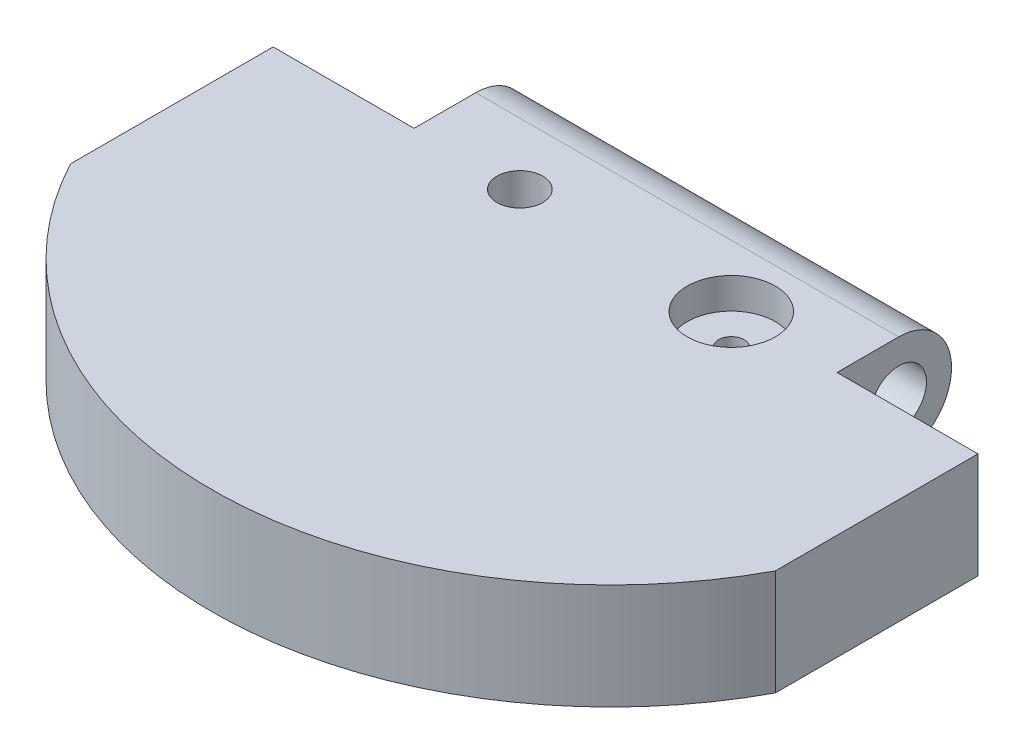
from build123d import *

# Parameters (mm, degrees)
BOSS_EXTRUDE1_DEPTH = 12
FILLET1_R           = 6
SKETCH2_R           = 3.15
CUT_EXTRUDE1_DEPTH  = 70
CUT_EXTRUDE2_START  = -12
SKETCH3_R           = 5
CUT_EXTRUDE2_DEPTH  = 3.5
SKETCH3_3_R         = 1.45
CUT_EXTRUDE3_DEPTH  = 13.5
SKETCH3_4_R         = 2.6
CUT_EXTRUDE4_DEPTH  = 4.4
SKETCH3_5_R         = 5
CUT_EXTRUDE5_DEPTH  = 3.5
SKETCH3_6_R         = 1.45
CUT_EXTRUDE6_DEPTH  = 18
CUT_EXTRUDE7_START  = -12
SKETCH3_7_R         = 2.6
CUT_EXTRUDE7_DEPTH  = 4.4


with BuildPart() as part:
    # Sketch1 → Boss-Extrude1 (new body)
    with BuildSketch(Plane(origin=(0, 0, 0), x_dir=(1, 0, 0), z_dir=(0, 1, 0))):
        with BuildLine():
            ThreePointArc((-40, -6), (-23.323807589, -23.539679293), (-2.2e-08, -30))
            ThreePointArc((-2.2e-08, -30), (23.32380757, -23.539679305), (40, -6))
            Line((40, -6), (40, 17))
            Line((40, 17), (24, 17))
            Line((24, 17), (24, 30))
            Line((24, 30), (-24, 30))
            Line((-24, 30), (-24, 17))
            Line((-24, 17), (-40, 17))
            Line((-40, 17), (-40, -6))
        make_face()
    extrude(amount=BOSS_EXTRUDE1_DEPTH)

    # Fillet1
    fillet1_edges = [part.edges().sort_by_distance(p)[0] for p in [
        (0, 0, -30),
        (0, 12, -30),
    ]]
    fillet(fillet1_edges, radius=FILLET1_R - 0.0001)  # a hair under: the kernel refuses the full size

    # Sketch2 → Cut-Extrude1 (cut)
    with BuildSketch(Plane.ZY.offset(24)):
        with Locations((-24, 6)):
            Circle(SKETCH2_R)
    extrude(amount=-CUT_EXTRUDE1_DEPTH, mode=Mode.SUBTRACT)

    # Sketch3 → Cut-Extrude2 (cut)
    with BuildSketch(Plane(origin=(0, 12, 0), x_dir=(1, 0, 0), z_dir=(0, 1, 0)).offset(CUT_EXTRUDE2_START)):
        with Locations(Location((-12, 17, 0), (0, 0, 270))):
            Circle(SKETCH3_R)
    extrude(amount=CUT_EXTRUDE2_DEPTH, mode=Mode.SUBTRACT)

    # Sketch3<3> → Cut-Extrude3 (cut)
    with BuildSketch(Plane(origin=(0, 12, 0), x_dir=(1, 0, 0), z_dir=(0, 1, 0))):
        with Locations(Location((-12, 17, 0), (0, 0, 270))):
            Circle(SKETCH3_3_R)
    extrude(amount=-CUT_EXTRUDE3_DEPTH, mode=Mode.SUBTRACT)

    # Sketch3<4> → Cut-Extrude4 (cut)
    with BuildSketch(Plane(origin=(0, 12, 0), x_dir=(1, 0, 0), z_dir=(0, 1, 0))):
        with Locations(Location((-12, 17, 0), (0, 0, 270))):
            Circle(SKETCH3_4_R)
    extrude(amount=-CUT_EXTRUDE4_DEPTH, mode=Mode.SUBTRACT)

    # Sketch3<5> → Cut-Extrude5 (cut)
    with BuildSketch(Plane(origin=(0, 12, 0), x_dir=(1, 0, 0), z_dir=(0, 1, 0))):
        with Locations(Location((12, 17, 0), (0, 0, 270))):
            Circle(SKETCH3_5_R)
    extrude(amount=-CUT_EXTRUDE5_DEPTH, mode=Mode.SUBTRACT)

    # Sketch3<6> → Cut-Extrude6 (cut)
    with BuildSketch(Plane(origin=(0, 12, 0), x_dir=(1, 0, 0), z_dir=(0, 1, 0))):
        with Locations(Location((12, 17, 0), (0, 0, 270))):
            Circle(SKETCH3_6_R)
    extrude(amount=-CUT_EXTRUDE6_DEPTH, mode=Mode.SUBTRACT)

    # Sketch3<7> → Cut-Extrude7 (cut)
    with BuildSketch(Plane(origin=(0, 12, 0), x_dir=(1, 0, 0), z_dir=(0, 1, 0)).offset(CUT_EXTRUDE7_START)):
        with Locations(Location((12, 17, 0), (0, 0, 270))):
            Circle(SKETCH3_7_R)
    extrude(amount=CUT_EXTRUDE7_DEPTH, mode=Mode.SUBTRACT)


solid = part.part
